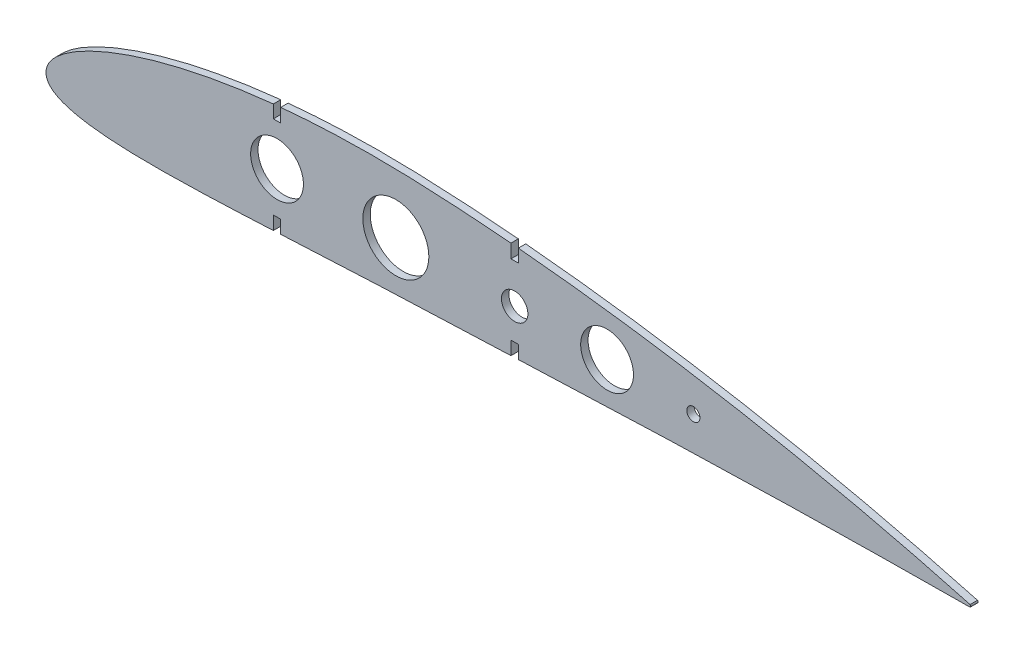
from build123d import *

# Parameters (mm, degrees)
SKETCH_2_R      = 10
SKETCH_2_R_2    = 5
SKETCH_2_R_3    = 12.5
SKETCH_2_R_4    = 2.5
EXTRUDE_1_DEPTH = 1.4


with BuildPart() as part:
    # Эскиз2 → Бобышка-Вытянуть1 (new, symmetric)
    with BuildSketch(Plane.XY):
        with BuildLine():
            Line((86.1, 32.682283633), (86.1, 27.785621096))
            Line((86.1, 27.785621096), (88.9, 27.785621096))
            Line((88.9, 27.785621096), (88.9, 32.962973681))
            add(Edge.make_bspline(
                [(176.1, 32.045532515), (173.460642448, 32.274383054), (167.786299659, 32.738244602), (159.079993996, 33.354548335), (150.013824851, 33.880339702), (141.037533969, 34.297759375), (132.176453799, 34.561309726), (123.418285188, 34.636133951), (114.728660276, 34.522388831), (106.092728827, 34.217419352), (97.485414888, 33.712894632), (91.763569037, 33.237837821), (88.9, 32.962973681)],
                knots=[0.48932836, 0.48932836, 0.48932836, 0.48932836, 0.51130307, 0.536551515, 0.561723366, 0.586628867, 0.611085431, 0.6352512, 0.659272176, 0.683163753, 0.706922144, 0.730783121, 0.730783121, 0.730783121, 0.730783121], degree=3))
            Line((176.1, 32.045532515), (176.1, 26.882916451))
            Line((176.1, 26.882916451), (178.9, 26.882916451))
            Line((178.9, 26.882916451), (178.9, 31.797856127))
            add(Edge.make_bspline(
                [(350, 0.441), (348.817934836, 0.763027745), (345.408245977, 1.69192274), (339.347864917, 3.301674674), (331.589665686, 5.302675511), (323.091885591, 7.417212373), (314.238285126, 9.538012439), (305.242760894, 11.608254886), (296.187367062, 13.60762908), (287.101376113, 15.529324906), (277.995159278, 17.370991017), (268.873317879, 19.131417094), (259.738667962, 20.809730625), (250.593474588, 22.404766691), (241.439890638, 23.915343362), (232.280043933, 25.339758978), (223.116153021, 26.676302541), (213.950527179, 27.922839844), (204.785615162, 29.076995056), (195.623903708, 30.135946559), (186.99647265, 31.041402296), (181.421156727, 31.570451189), (178.9, 31.797856127)],
                knots=[0, 0, 0, 0, 0.0101622, 0.029313053, 0.052011605, 0.076619468, 0.101948061, 0.127526132, 0.153184131, 0.178867888, 0.204557903, 0.230245712, 0.255925967, 0.281594302, 0.30724642, 0.332878042, 0.358484538, 0.384061186, 0.409602822, 0.435103874, 0.460559416, 0.481556447, 0.481556447, 0.481556447, 0.481556447], degree=3))
            ThreePointArc((350, 0.441), (350.182668182, 0), (350, -0.441))
            add(Edge.make_bspline(
                [(178.9, -4.758637273), (181.652979317, -4.646278606), (187.626173611, -4.403273739), (196.81461857, -4.035333009), (206.460819266, -3.659492142), (216.093643375, -3.297876981), (225.715061788, -2.95311789), (235.327217645, -2.627287704), (244.932209931, -2.322100346), (254.532034352, -2.038929372), (264.128528247, -1.778536728), (273.723303235, -1.541558038), (283.317346051, -1.328064065), (292.909735844, -1.138021673), (302.493517153, -0.971016602), (312.041013985, -0.826421034), (321.464682241, -0.704096652), (330.522295396, -0.604119869), (338.773087678, -0.527128646), (345.182558015, -0.475350241), (348.76868735, -0.44977974), (350, -0.441)],
                knots=[0.517634386, 0.517634386, 0.517634386, 0.517634386, 0.540928595, 0.568176028, 0.595379569, 0.622543445, 0.64967326, 0.676775201, 0.703855228, 0.730918775, 0.757971338, 0.785017763, 0.812061651, 0.839103366, 0.866131651, 0.893099152, 0.919831065, 0.945809917, 0.969680601, 0.989589706, 1, 1, 1, 1], degree=3))
            Line((178.9, -4.758637273), (178.9, 0.224194977))
            Line((178.9, 0.224194977), (176.1, 0.224194977))
            Line((176.1, 0.224194977), (176.1, -4.873020948))
            add(Edge.make_bspline(
                [(88.9, -8.693267562), (89.617844041, -8.657365264), (93.544099689, -8.4603043), (100.675081793, -8.097607246), (110.279925807, -7.615552634), (119.854698054, -7.155331752), (129.404950626, -6.726934654), (138.957043666, -6.344774315), (148.536329767, -5.989584537), (158.156896352, -5.604325894), (167.348797605, -5.231176131), (173.335752744, -4.986028102), (176.1, -4.873020948)],
                knots=[0.263757046, 0.263757046, 0.263757046, 0.263757046, 0.269833583, 0.296993022, 0.324123272, 0.351139107, 0.378035509, 0.404946016, 0.431960837, 0.459078395, 0.4863474, 0.509737017, 0.509737017, 0.509737017, 0.509737017], degree=3))
            Line((88.9, -8.693267562), (88.9, -3.723116029))
            Line((88.9, -3.723116029), (86.1, -3.723116029))
            Line((86.1, -3.723116029), (86.1, -8.832579685))
            add(Edge.make_bspline(
                [(0.067165, 0.869995), (0.031799348, 0.52288612), (-0.038949105, -0.171499965), (0.109187697, -1.238208426), (0.489573911, -2.294373299), (1.140063589, -3.311096493), (2.048873093, -4.254985343), (3.207362223, -5.125399257), (4.62830025, -5.930091469), (6.349357867, -6.683143801), (8.441643964, -7.39506903), (11.016573701, -8.071443347), (14.236363949, -8.71040323), (18.305613464, -9.295466224), (23.419361508, -9.790139433), (29.665932935, -10.146283203), (36.959978182, -10.327294388), (45.07635799, -10.326759678), (53.756929463, -10.166011212), (62.800670475, -9.879297901), (72.081160335, -9.501034945), (79.871929674, -9.138172062), (84.562006059, -8.908655535), (86.1, -8.832579685)],
                knots=[0, 0, 0, 0, 0.002941446, 0.005884319, 0.00901613, 0.012364547, 0.016007934, 0.020036845, 0.024573728, 0.029783835, 0.03589701, 0.04324044, 0.052275965, 0.063634589, 0.077983176, 0.095698161, 0.116520086, 0.13966073, 0.16431217, 0.18991889, 0.216157201, 0.242837762, 0.255856498, 0.255856498, 0.255856498, 0.255856498], degree=3))
            add(Edge.make_bspline(
                [(86.1, 32.682283633), (84.251034658, 32.488999326), (79.618112888, 31.965003077), (72.248067764, 30.96669173), (64.042160436, 29.619190205), (55.994200632, 28.049519945), (48.157087779, 26.258842728), (40.614534945, 24.258661851), (33.496117772, 22.08061089), (26.978950376, 19.787977208), (21.250737748, 17.476669613), (16.436666106, 15.253855393), (12.543120617, 13.201408311), (9.465247652, 11.352044479), (7.047193647, 9.694493277), (5.140372907, 8.19592153), (3.628941572, 6.819827516), (2.433445936, 5.533634041), (1.497819162, 4.313324923), (0.800303575, 3.138270943), (0.302083458, 2.003099556), (0.143157814, 1.236538372), (0.067165, 0.869995)],
                knots=[0.738563451, 0.738563451, 0.738563451, 0.738563451, 0.7539832, 0.77723469, 0.800246382, 0.822950709, 0.845237155, 0.866915896, 0.887662335, 0.906968281, 0.924203157, 0.938878975, 0.950931611, 0.960693484, 0.968646729, 0.975232933, 0.980794744, 0.985583761, 0.989781539, 0.993521313, 0.996902113, 1, 1, 1, 1], degree=3))
        make_face()
        with Locations((87.5, 12.031252534)):
            Circle(SKETCH_2_R, mode=Mode.SUBTRACT)
        with Locations((177.5, 12.031252534)):
            Circle(SKETCH_2_R_2, mode=Mode.SUBTRACT)
        with Locations((132.5, 12.031252534)):
            Circle(SKETCH_2_R_3, mode=Mode.SUBTRACT)
        with Locations((212.5, 12.031252534)):
            Circle(SKETCH_2_R, mode=Mode.SUBTRACT)
        with Locations((245.182668182, 10.487815621)):
            Circle(SKETCH_2_R_4, mode=Mode.SUBTRACT)
    extrude(amount=EXTRUDE_1_DEPTH, both=True)


solid = part.part
